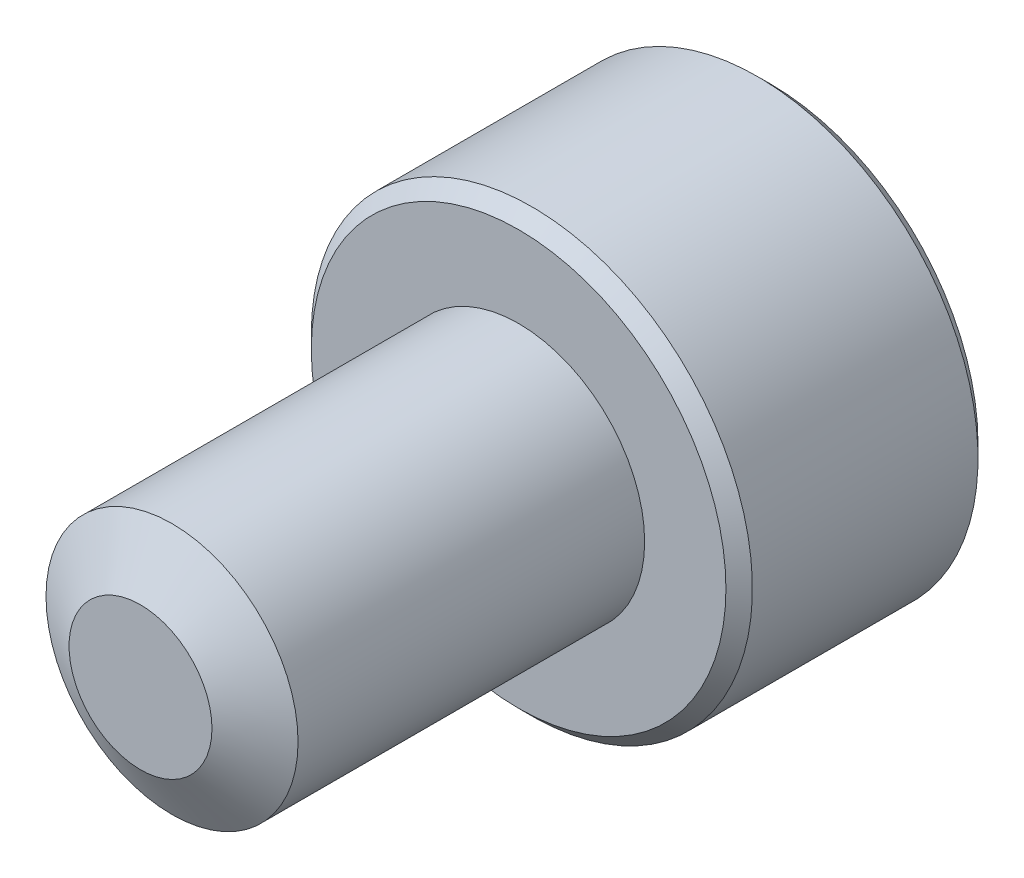
from build123d import *

# Parameters (mm, degrees)
SKETCH1_R           = 2
EXTRUDE1_DEPTH      = 6
CUT_SWEEP1_PITCH    = 0.7
SKETCH6_R           = 3.5
EXTRUDE2_DEPTH      = 4
CUT_EXTRUDE1_DEPTH  = 2.25
CHAMFER1_SIZE       = 0.21
SKETCH12_R          = 2
BOSS_EXTRUDE1_DEPTH = 6
CHAMFER2_SIZE       = 0.5
CHAMFER2_SIZE_2     = 0.866025404


with BuildPart() as part:
    # Sketch1 → Extrude1 (new body)
    with BuildSketch(Plane.XY):
        Circle(SKETCH1_R)
    extrude(amount=-EXTRUDE1_DEPTH)

    # Cut-Sweep1: the profile of Sketch3 profile screwed along a right-hand helix of 9.571429 turns, 6 arcs to a turn; built about Z, then put on its axis
    cut_sweep1_z = Axis((0, 0, 0), (0, 0, 1))
    cut_sweep1_corners = [(2.0003, 0, -0.612673205), (1.545336663, 0, -0.35), (1.545336663, 0, -0.2625), (2.0003, 0, 0.000173205)]
    with BuildLine(mode=Mode.PRIVATE) as cut_sweep1_profile:
        Line(cut_sweep1_corners[0], cut_sweep1_corners[1])
        Line(cut_sweep1_corners[1], cut_sweep1_corners[2])
        Line(cut_sweep1_corners[2], cut_sweep1_corners[3])
        Line(cut_sweep1_corners[3], cut_sweep1_corners[0])
    cut_sweep1_cap = Face(cut_sweep1_profile.wire())
    cut_sweep1_turn_angles = [0, 30, 60, 90, 120, 150, 180, 210, 240, 270, 300, 330, 360]
    cut_sweep1_turn_weights = [1, 0.8660254037844387, 1, 0.8660254037844387, 1, 0.8660254037844387, 1, 0.8660254037844387, 1, 0.8660254037844387, 1, 0.8660254037844387, 1]
    cut_sweep1_turn_rails = [Edge.make_bspline([Vector(p[0], p[1], 0).rotate(cut_sweep1_z, cut_sweep1_turn_angles[k]) / cut_sweep1_turn_weights[k] + Vector(0, 0, p[2] + CUT_SWEEP1_PITCH * cut_sweep1_turn_angles[k] / 360) for k in range(13)], [0, 0, 0, 1, 1, 2, 2, 3, 3, 4, 4, 5, 5, 6, 6, 6], 2, cut_sweep1_turn_weights) for p in cut_sweep1_corners]
    cut_sweep1_turn_sides = [Face.make_surface_from_curves(cut_sweep1_turn_rails[p[0]], cut_sweep1_turn_rails[p[1]]) for p in [(0, 1), (1, 2), (2, 3), (3, 0)]]
    cut_sweep1_last_angles = [3240, 3270, 3300, 3330, 3360, 3390, 3420, 3432.857142857, 3445.714285714]
    cut_sweep1_last_weights = [1, 0.8660254037844387, 1, 0.8660254037844387, 1, 0.8660254037844387, 1, 0.9749279121818499, 1]
    cut_sweep1_last_rails = [Edge.make_bspline([Vector(p[0], p[1], 0).rotate(cut_sweep1_z, cut_sweep1_last_angles[k]) / cut_sweep1_last_weights[k] + Vector(0, 0, p[2] + CUT_SWEEP1_PITCH * cut_sweep1_last_angles[k] / 360) for k in range(9)], [0, 0, 0, 1, 1, 2, 2, 3, 3, 4, 4, 4], 2, cut_sweep1_last_weights) for p in cut_sweep1_corners]
    cut_sweep1_last_sides = [Face.make_surface_from_curves(cut_sweep1_last_rails[p[0]], cut_sweep1_last_rails[p[1]]) for p in [(0, 1), (1, 2), (2, 3), (3, 0)]]
    cut_sweep1 = Plane(origin=(0, 0, 0), x_dir=(0, 1, 0), z_dir=(0, 0, -1)) * Solid(Shell([*[p.moved(Location((0, 0, CUT_SWEEP1_PITCH * i))) for i in range(9) for p in cut_sweep1_turn_sides], *cut_sweep1_last_sides, cut_sweep1_cap, cut_sweep1_cap.rotate(cut_sweep1_z, 3445.714285714).moved(Location((0, 0, CUT_SWEEP1_PITCH * 3445.714285714 / 360)))]))
    add(cut_sweep1, mode=Mode.SUBTRACT)

    # Sketch4 → Cut-Revolve1 (revolve, cut)
    with BuildSketch(Plane(origin=(0, 0, 0), x_dir=(0, 0, -1), z_dir=(1, 0, 0)), mode=Mode.PRIVATE) as cut_revolve1_sk:
        Polygon((0.496211411, 2), (0, 1.291336663), (0, 2), align=None)
    revolve(cut_revolve1_sk.sketch.rotate(Axis((0, 0, 0), (0, 0, -1)), 271.401126896), axis=Axis((0, 0, 0), (0, 0, -1)), mode=Mode.SUBTRACT)

    # Sketch6 → Extrude2 (add)
    with BuildSketch(Plane(origin=(0, 0, -6), x_dir=(-1, 0, 0), z_dir=(0, 0, -1))):
        Circle(SKETCH6_R)
    extrude(amount=EXTRUDE2_DEPTH)

    # Sketch7 → Cut-Extrude1 (cut)
    with BuildSketch(Plane(origin=(0, 0, -10), x_dir=(-1, 0, 0), z_dir=(0, 0, -1))):
        Polygon((0, 1.732050808), (-1.5, 0.866025404), (-1.5, -0.866025404), (0, -1.732050808), (1.5, -0.866025404), (1.5, 0.866025404), align=None)
    extrude(amount=-CUT_EXTRUDE1_DEPTH, mode=Mode.SUBTRACT)

    # Cut-Extrude2 cone 1 section (through the dimple's axis) → Cut-Extrude2 (revolve, cut)
    with BuildSketch(Plane(origin=(0, 0, -10), x_dir=(0, 1, 0), z_dir=(1, 0, 0))):
        Polygon((0, 0), (1.732050808, 0), (0, 1.732050808), align=None)
    revolve(axis=Axis((0, 0, -10), (0, 0, 1)), mode=Mode.SUBTRACT)

    # Chamfer1
    chamfer1_edges = [part.edges().sort_by_distance(p)[0] for p in [
        (3.5, 0, -6),
        (3.5, 0, -10),
    ]]
    chamfer(chamfer1_edges, length=CHAMFER1_SIZE)

    # Sketch10 → Revolve1 (revolve)
    with BuildSketch(Plane(origin=(0, 0, 0), x_dir=(0, 0, -1), z_dir=(1, 0, 0)), mode=Mode.PRIVATE) as revolve1_sk:
        Polygon((6, 2), (6, 0), (4.996572875, 0), (5.825, 2), align=None)
    revolve(revolve1_sk.sketch.rotate(Axis((0, 0, -6), (0, 0, 1)), 270), axis=Axis((0, 0, -6), (0, 0, 1)))

    # Sketch12 → Boss-Extrude1 (add)
    with BuildSketch(Plane.XY):
        Circle(SKETCH12_R)
    extrude(amount=-BOSS_EXTRUDE1_DEPTH)

    # Chamfer2
    # the kernel refuses this chamfer: 0.866025404, 0.5 mm, written as the material it takes off along each edge
    with BuildSketch(Plane(origin=(0, 0, 0), x_dir=(1, 0, 0), z_dir=(0, -1, 0))) as chamfer2_piece_1:
        Polygon((2, -CHAMFER2_SIZE), (2 - CHAMFER2_SIZE_2, 0), (2, 0), align=None)
    revolve(axis=Axis((0, 0, 0), (0, 0, 1)), mode=Mode.SUBTRACT)


solid = part.part
